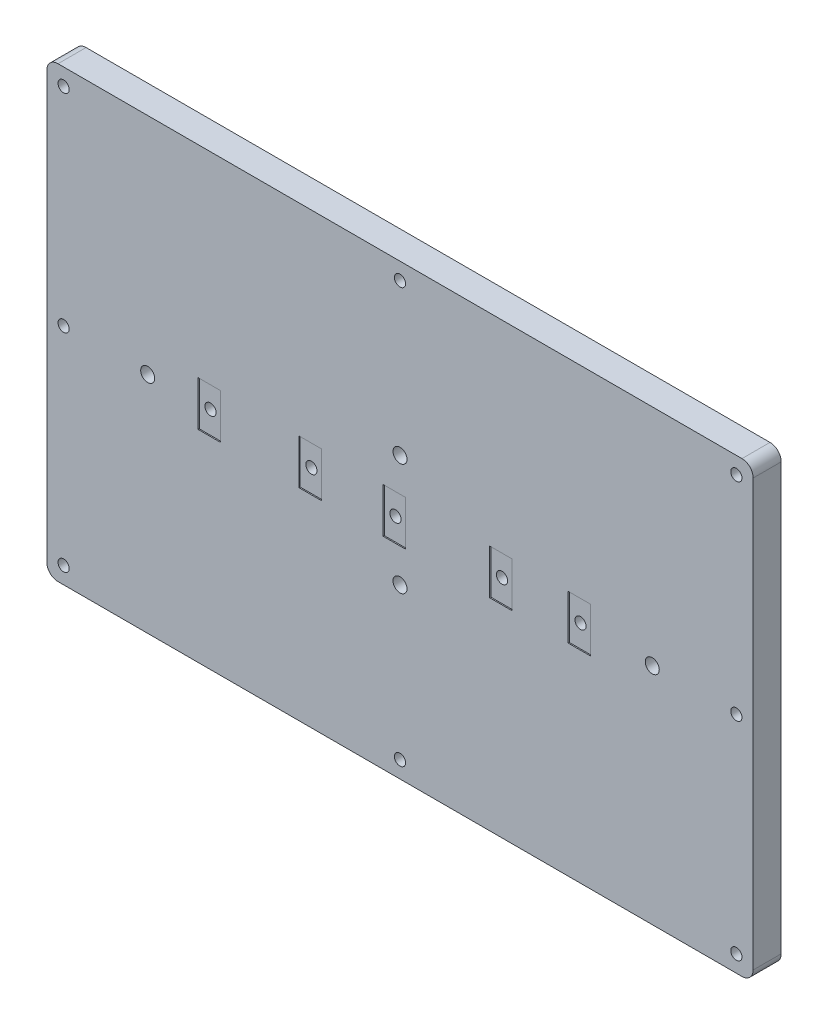
from build123d import *

# Parameters (mm, degrees)
BOSS_EXTRUDE1_DEPTH = 5
CUT_EXTRUDE1_DEPTH  = 0.1
SKETCH10_R          = 1
CUT_EXTRUDE2_DEPTH  = 4.6
SKETCH11_W          = 4
SKETCH11_H          = 8
CUT_EXTRUDE6_DEPTH  = 0.2
SKETCH8_W           = 10
SKETCH8_H           = 2
CUT_EXTRUDE7_DEPTH  = 0.2
SKETCH12_R          = 1.25
CUT_EXTRUDE8_DEPTH  = 4
SKETCH13_R          = 1
CUT_EXTRUDE9_DEPTH  = 5


with BuildPart() as part:
    # Sketch1 → Boss-Extrude1 (new body)
    with BuildSketch(Plane.XY):
        with BuildLine():
            Line((-61, 40), (61, 40))
            ThreePointArc((61, 40), (62.414213562, 39.414213562), (63, 38))
            Line((63, 38), (63, -38))
            ThreePointArc((63, -38), (62.414213562, -39.414213562), (61, -40))
            Line((61, -40), (-61, -40))
            ThreePointArc((-61, -40), (-62.414213562, -39.414213562), (-63, -38))
            Line((-63, -38), (-63, 38))
            ThreePointArc((-63, 38), (-62.414213562, 39.414213562), (-61, 40))
        make_face()
    extrude(amount=BOSS_EXTRUDE1_DEPTH)

    # Sketch2 → Cut-Extrude1 (cut)
    with BuildSketch(Plane.XY):
        with BuildLine():
            Line((-5, 5.116904811), (-5, -5.116904811))
            ThreePointArc((-5, -5.116904811), (-4.746349407, -5.552004764), (-4.242752122, -5.545651273))
            Line((-4.242752122, -5.545651273), (4.285422562, -0.428746463))
            ThreePointArc((4.285422562, -0.428746463), (4.528174684, 0), (4.285422562, 0.428746463))
            Line((4.285422562, 0.428746463), (-4.242752122, 5.545651273))
            ThreePointArc((-4.242752122, 5.545651273), (-4.746349407, 5.552004764), (-5, 5.116904811))
        make_face()
        with BuildLine():
            Line((-10, -1.5), (-10, 1.5))
            ThreePointArc((-10, 1.5), (-10.146446609, 1.853553391), (-10.5, 2))
            Line((-10.5, 2), (-14, 2))
            Line((-14, 2), (-14, 5.5))
            ThreePointArc((-14, 5.5), (-14.146446609, 5.853553391), (-14.5, 6))
            Line((-14.5, 6), (-17.5, 6))
            ThreePointArc((-17.5, 6), (-17.853553391, 5.853553391), (-18, 5.5))
            Line((-18, 5.5), (-18, 2))
            Line((-18, 2), (-21.5, 2))
            ThreePointArc((-21.5, 2), (-21.853553391, 1.853553391), (-22, 1.5))
            Line((-22, 1.5), (-22, -1.5))
            ThreePointArc((-22, -1.5), (-21.853553391, -1.853553391), (-21.5, -2))
            Line((-21.5, -2), (-18, -2))
            Line((-18, -2), (-18, -5.5))
            ThreePointArc((-18, -5.5), (-17.853553391, -5.853553391), (-17.5, -6))
            Line((-17.5, -6), (-14.5, -6))
            ThreePointArc((-14.5, -6), (-14.146446609, -5.853553391), (-14, -5.5))
            Line((-14, -5.5), (-14, -2))
            Line((-14, -2), (-10.5, -2))
            ThreePointArc((-10.5, -2), (-10.146446609, -1.853553391), (-10, -1.5))
        make_face()
        with BuildLine():
            Line((-28, 1.5), (-28, -1.5))
            ThreePointArc((-28, -1.5), (-28.146446609, -1.853553391), (-28.5, -2))
            Line((-28.5, -2), (-39.5, -2))
            ThreePointArc((-39.5, -2), (-39.853553391, -1.853553391), (-40, -1.5))
            Line((-40, -1.5), (-40, 1.5))
            ThreePointArc((-40, 1.5), (-39.853553391, 1.853553391), (-39.5, 2))
            Line((-39.5, 2), (-28.5, 2))
            ThreePointArc((-28.5, 2), (-28.146446609, 1.853553391), (-28, 1.5))
        make_face()
        with BuildLine():
            Line((10, 4.5), (10, -4.5))
            ThreePointArc((10, -4.5), (10.146446609, -4.853553391), (10.5, -5))
            Line((10.5, -5), (12.5, -5))
            ThreePointArc((12.5, -5), (12.853553391, -4.853553391), (13, -4.5))
            Line((13, -4.5), (13, -2))
            Line((13, -2), (21.296930767, -5.687524785))
            ThreePointArc((21.296930767, -5.687524785), (21.77245677, -5.64986513), (22, -5.230619011))
            Line((22, -5.230619011), (22, 5.230619011))
            ThreePointArc((22, 5.230619011), (21.77245677, 5.64986513), (21.296930767, 5.687524785))
            Line((21.296930767, 5.687524785), (13, 2))
            Line((13, 2), (13, 4.5))
            ThreePointArc((13, 4.5), (12.853553391, 4.853553391), (12.5, 5))
            Line((12.5, 5), (10.5, 5))
            ThreePointArc((10.5, 5), (10.146446609, 4.853553391), (10, 4.5))
        make_face()
        with BuildLine():
            Line((28, 5.230619011), (28, -5.230619011))
            ThreePointArc((28, -5.230619011), (28.22754323, -5.64986513), (28.703069233, -5.687524785))
            Line((28.703069233, -5.687524785), (37, -2))
            Line((37, -2), (37, -4.5))
            ThreePointArc((37, -4.5), (37.146446609, -4.853553391), (37.5, -5))
            Line((37.5, -5), (39.5, -5))
            ThreePointArc((39.5, -5), (39.853553391, -4.853553391), (40, -4.5))
            Line((40, -4.5), (40, 4.5))
            ThreePointArc((40, 4.5), (39.853553391, 4.853553391), (39.5, 5))
            Line((39.5, 5), (37.5, 5))
            ThreePointArc((37.5, 5), (37.146446609, 4.853553391), (37, 4.5))
            Line((37, 4.5), (37, 2))
            Line((37, 2), (28.703069233, 5.687524785))
            ThreePointArc((28.703069233, 5.687524785), (28.22754323, 5.64986513), (28, 5.230619011))
        make_face()
    extrude(amount=CUT_EXTRUDE1_DEPTH, mode=Mode.SUBTRACT)

    # Sketch10 → Cut-Extrude2 (cut)
    with BuildSketch(Plane.XY.offset(5)):
        with Locations((-34, 0)):
            Circle(SKETCH10_R)
        with Locations((-16, 0)):
            Circle(SKETCH10_R)
        with Locations((-1, 0)):
            Circle(SKETCH10_R)
        with Locations((18, 0)):
            Circle(SKETCH10_R)
        with Locations((32, 0)):
            Circle(SKETCH10_R)
    extrude(amount=-CUT_EXTRUDE2_DEPTH, mode=Mode.SUBTRACT)

    # Sketch11 → Cut-Extrude6 (cut)
    with BuildSketch(Plane.XY.offset(5)):
        with Locations((-34, 0)):
            Rectangle(SKETCH11_W, SKETCH11_H)
        with Locations((-16, 0)):
            Rectangle(SKETCH11_W, SKETCH11_H)
        with Locations((-1, 0)):
            Rectangle(SKETCH11_W, SKETCH11_H)
        with Locations((18, 0)):
            Rectangle(SKETCH11_W, SKETCH11_H)
        with Locations((32, 0)):
            Rectangle(SKETCH11_W, SKETCH11_H)
    extrude(amount=-CUT_EXTRUDE6_DEPTH, mode=Mode.SUBTRACT)

    # Sketch8 → Cut-Extrude7 (cut)
    with BuildSketch(Plane.XY.offset(0.5)):
        Polygon((-21, 1), (-17, 1), (-17, 5), (-15, 5), (-15, 1), (-11, 1), (-11, -1), (-15, -1), (-15, -5), (-17, -5), (-17, -1), (-21, -1), align=None)
        with Locations((-34, 0)):
            Rectangle(SKETCH8_W, SKETCH8_H)
        Polygon((-4, 4), (-4, -4), (3, 0), align=None)
        Polygon((29, 4), (29, -4), (39, 0), align=None)
        Polygon((11, 0), (21, -4), (21, 4), align=None)
    extrude(amount=CUT_EXTRUDE7_DEPTH, mode=Mode.SUBTRACT)

    # Sketch12 → Cut-Extrude8 (cut)
    with BuildSketch(Plane.XY.offset(5)):
        with Locations((-45, 0)):
            Circle(SKETCH12_R)
        with Locations((45, 0)):
            Circle(SKETCH12_R)
        with Locations((0, 10)):
            Circle(SKETCH12_R)
        with Locations((0, -10)):
            Circle(SKETCH12_R)
    extrude(amount=-CUT_EXTRUDE8_DEPTH, mode=Mode.SUBTRACT)

    # Sketch13 → Cut-Extrude9 (cut)
    with BuildSketch(Plane.XY.offset(5)):
        with Locations((60, 37)):
            Circle(SKETCH13_R)
        with Locations((60, -37)):
            Circle(SKETCH13_R)
        with Locations((-60, -37)):
            Circle(SKETCH13_R)
        with Locations((-60, 37)):
            Circle(SKETCH13_R)
        with Locations((0, 37)):
            Circle(SKETCH13_R)
        with Locations((0, -37)):
            Circle(SKETCH13_R)
        with Locations((-60, 0)):
            Circle(SKETCH13_R)
        with Locations((60, 0)):
            Circle(SKETCH13_R)
    extrude(amount=-CUT_EXTRUDE9_DEPTH, mode=Mode.SUBTRACT)


solid = part.part
